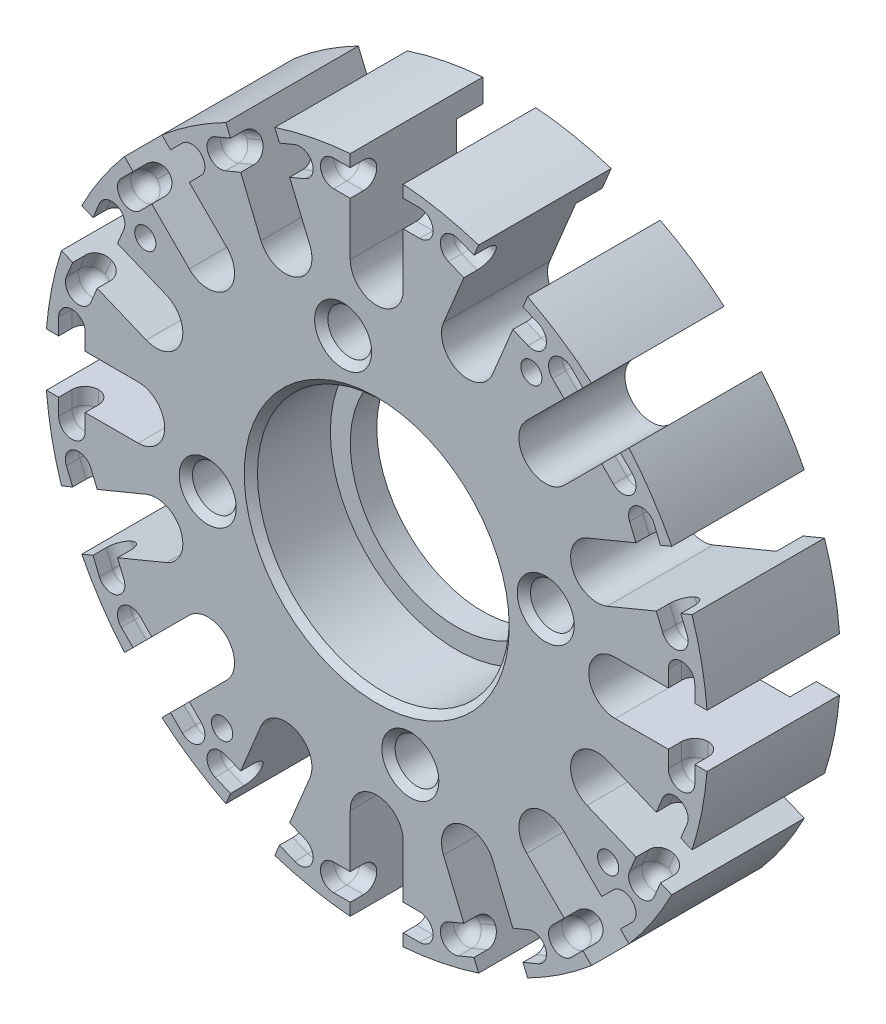
from build123d import *

# Parameters (mm, degrees)
SKETCH_1_R               = 25
EXTRUDE_1_DEPTH          = 10
SKETCH_10_R              = 8
CUT_EXTRUDE_7_DEPTH      = 10
SKETCH_6_R               = 23.25
CUT_EXTRUDE_6_DEPTH      = 2
SKETCH_2_R               = 9.5
CUT_EXTRUDE_2_DEPTH      = 6
SKETCH_3_R               = 1.65
CUT_EXTRUDE_3_DEPTH      = 10
PATTERN_CIRCULAR_1_COUNT = 4
CUT_EXTRUDE_START        = -10
CUT_EXTRUDE_5_DEPTH      = 10
PATTERN_CIRCULAR_3_COUNT = 16
CHAMFER_1_SIZE           = 0.5
CUT_EXTRUDE_10_DEPTH     = 2
FILLET_3_R               = 1
PATTERN_CIRCULAR_6_COUNT = 16
HOLE_WIZARD_M2_1_D       = 1.6
PATTERN_CIRCULAR_7_COUNT = 4
CHAMFER_3_SIZE           = 0.25
CHAMFER_3_SIZE2          = 0.066987298
FILLET_5_R               = 1
FILLET_6_R               = 1


with BuildPart() as part:
    # 草图1 → 拉伸1 (new body)
    with BuildSketch(Plane.XY):
        Circle(SKETCH_1_R)
    extrude(amount=EXTRUDE_1_DEPTH)

    # 草图10 → 拉伸7 (cut)
    with BuildSketch(Plane.XY.offset(10)):
        Circle(SKETCH_10_R)
    extrude(amount=-CUT_EXTRUDE_7_DEPTH, mode=Mode.SUBTRACT)

    # 草图6 → 拉伸6 (cut)
    with BuildSketch(Plane(origin=(0, 0, 0), x_dir=(-1, 0, 0), z_dir=(0, 0, -1))):
        Circle(SKETCH_6_R)
    extrude(amount=-CUT_EXTRUDE_6_DEPTH, mode=Mode.SUBTRACT)

    # 草图2 → 拉伸2 (cut)
    with BuildSketch(Plane.XY.offset(10)):
        Circle(SKETCH_2_R)
    extrude(amount=-CUT_EXTRUDE_2_DEPTH, mode=Mode.SUBTRACT)

    # 草图3 → 拉伸3 (cut)
    with BuildSketch(Plane.XY.offset(10)):
        with Locations((-2.536174186, 12.750208645)):
            Circle(SKETCH_3_R)
    cut_extrude_3 = extrude(amount=-CUT_EXTRUDE_3_DEPTH, mode=Mode.SUBTRACT)

    # 阵列(圆周)1: 拉伸3 ×4 about axis
    pattern_circular_1_axis = Axis((0, 0, 0), (0, 0, 1))
    for i in range(1, PATTERN_CIRCULAR_1_COUNT):
        add(cut_extrude_3.rotate(pattern_circular_1_axis, i * 360 / PATTERN_CIRCULAR_1_COUNT), mode=Mode.SUBTRACT)

    # 草图5 → 拉伸5 (cut)
    with BuildSketch(Plane.XY.offset(10).offset(CUT_EXTRUDE_START)):
        with BuildLine():
            Line((-18, 2), (-24.919871589, 2))
            ThreePointArc((-24.919871589, 2), (-25, 0), (-24.919871589, -2))
            Line((-24.919871589, -2), (-18, -2))
            ThreePointArc((-18, -2), (-16, 0), (-18, 2))
        make_face()
    cut_extrude_5 = extrude(amount=CUT_EXTRUDE_5_DEPTH, mode=Mode.SUBTRACT)

    # 阵列(圆周)3: 拉伸5 ×16 about axis
    pattern_circular_3_axis = Axis((0, 0, 0), (0, 0, 1))
    for i in range(1, PATTERN_CIRCULAR_3_COUNT):
        add(cut_extrude_5.rotate(pattern_circular_3_axis, i * 360 / PATTERN_CIRCULAR_3_COUNT), mode=Mode.SUBTRACT)

    # 倒角1
    chamfer_1_edges = [part.edges().sort_by_distance(p)[0] for p in [
        (-9.5, 0, 10),
        (-4.186174186, 12.750208645, 10),
        (-12.750208645, -4.186174186, 10),
        (4.186174186, -12.750208645, 10),
        (12.750208645, 4.186174186, 10),
    ]]
    chamfer(chamfer_1_edges, length=CHAMFER_1_SIZE)

    # 草图15 → 拉伸10 (cut)
    with BuildSketch(Plane.XY.offset(10)):
        with BuildLine():
            Line((-24, 3.25), (-24, -3.25))
            ThreePointArc((-24, -3.25), (-23, -4.25), (-22, -3.25))
            Line((-22, -3.25), (-22, 3.25))
            ThreePointArc((-22, 3.25), (-23, 4.25), (-24, 3.25))
        make_face()
    cut_extrude_10 = extrude(amount=-CUT_EXTRUDE_10_DEPTH, mode=Mode.SUBTRACT)

    # 圆角3
    fillet_3_edges = [part.edges().sort_by_distance(p)[0] for p in [
        (-22, -2.625, 8),
        (-22, 2.625, 8),
        (-24, -2.625, 8),
        (-24, 2.625, 8),
        (-23, -4.25, 8),
        (-23, 4.25, 8),
    ]]
    fillet(fillet_3_edges, radius=FILLET_3_R - 0.0001)  # a hair under: the kernel refuses the full size

    # 阵列(圆周)6: 拉伸10 ×16 about axis
    pattern_circular_6_axis = Axis((0, 0, 0), (0, 0, 1))
    for i in range(1, PATTERN_CIRCULAR_6_COUNT):
        add(cut_extrude_10.rotate(pattern_circular_6_axis, i * 360 / PATTERN_CIRCULAR_6_COUNT), mode=Mode.SUBTRACT)

    # M2 螺纹孔1 (through all)
    with Locations(Plane(origin=(11.666974893, 17.460861858, 2), x_dir=(-1, 0, 0), z_dir=(0, 0, -1))):
        with Locations((0, 0)):
            hole_wizard_m2_1 = Hole(HOLE_WIZARD_M2_1_D / 2)

    # 阵列(圆周)7: M2 螺纹孔1 ×4 about axis
    pattern_circular_7_axis = Axis((0, 0, 0), (0, 0, 1))
    for i in range(1, PATTERN_CIRCULAR_7_COUNT):
        add(hole_wizard_m2_1.rotate(pattern_circular_7_axis, i * 360 / PATTERN_CIRCULAR_7_COUNT), mode=Mode.SUBTRACT)

    # 倒角3
    chamfer_3_edges = [part.edges().sort_by_distance(p)[0] for p in [
        (10.866974893, 17.460861858, 2),
        (-17.460861858, 10.866974893, 2),
        (-10.866974893, -17.460861858, 2),
        (17.460861858, -10.866974893, 2),
    ]]
    chamfer_3_side = [part.faces().sort_by_distance(p)[0] for p in [
        (-15.344828267, 0, 2),
    ]]
    chamfer(chamfer_3_edges, length=CHAMFER_3_SIZE, length2=CHAMFER_3_SIZE2, reference=chamfer_3_side[0])

    # 圆角5
    fillet_5_edges = [part.edges().sort_by_distance(p)[0] for p in [
        (-17.412504487, -13.700193885, 8),
        (-18.826718049, -15.114407448, 8),
        (-15.114407448, -18.826718049, 8),
        (-13.700193885, -17.412504487, 8),
        (-21.16856477, -11.60958615, 8),
        (-19.320805705, -10.844219285, 8),
        (-21.329893725, -5.993851739, 8),
        (-23.17765279, -6.759218604, 8),
        (-19.268659787, -13.258252147, 8),
        (-13.258252147, -19.268659787, 8),
        (-19.62282466, -12.728206958, 8),
        (-22.875633835, -4.875230931, 8),
    ]]
    fillet(fillet_5_edges, radius=FILLET_5_R - 0.0001)  # a hair under: the kernel refuses the full size

    # 圆角6
    fillet_6_edges = [part.edges().sort_by_distance(p)[0] for p in [
        (-23.17765279, 6.759218604, 8),
        (-21.329893725, 5.993851739, 8),
        (-19.320805705, 10.844219285, 8),
        (-21.16856477, 11.60958615, 8),
        (-18.826718049, 15.114407448, 8),
        (-17.412504487, 13.700193885, 8),
        (-13.700193885, 17.412504487, 8),
        (-15.114407448, 18.826718049, 8),
        (-11.60958615, 21.16856477, 8),
        (-10.844219285, 19.320805705, 8),
        (-5.993851739, 21.329893725, 8),
        (-6.759218604, 23.17765279, 8),
        (-2.625, 24, 8),
        (-2.625, 22, 8),
        (2.625, 22, 8),
        (2.625, 24, 8),
        (6.759218604, 23.17765279, 8),
        (5.993851739, 21.329893725, 8),
        (10.844219285, 19.320805705, 8),
        (11.60958615, 21.16856477, 8),
        (15.114407448, 18.826718049, 8),
        (13.700193885, 17.412504487, 8),
        (17.412504487, 13.700193885, 8),
        (18.826718049, 15.114407448, 8),
        (21.16856477, 11.60958615, 8),
        (19.320805705, 10.844219285, 8),
        (21.329893725, 5.993851739, 8),
        (23.17765279, 6.759218604, 8),
        (24, 2.625, 8),
        (22, 2.625, 8),
        (22, -2.625, 8),
        (24, -2.625, 8),
        (23.17765279, -6.759218604, 8),
        (21.329893725, -5.993851739, 8),
        (19.320805705, -10.844219285, 8),
        (21.16856477, -11.60958615, 8),
        (18.826718049, -15.114407448, 8),
        (17.412504487, -13.700193885, 8),
        (13.700193885, -17.412504487, 8),
        (15.114407448, -18.826718049, 8),
        (11.60958615, -21.16856477, 8),
        (10.844219285, -19.320805705, 8),
        (5.993851739, -21.329893725, 8),
        (6.759218604, -23.17765279, 8),
        (2.625, -24, 8),
        (2.625, -22, 8),
        (-2.625, -22, 8),
        (-2.625, -24, 8),
        (-6.759218604, -23.17765279, 8),
        (-5.993851739, -21.329893725, 8),
        (-10.844219285, -19.320805705, 8),
        (-11.60958615, -21.16856477, 8),
        (-22.875633835, 4.875230931, 8),
        (-19.62282466, 12.728206958, 8),
        (-19.268659787, 13.258252147, 8),
        (-13.258252147, 19.268659787, 8),
        (-12.728206958, 19.62282466, 8),
        (-4.875230931, 22.875633835, 8),
        (-4.25, 23, 8),
        (4.25, 23, 8),
        (4.875230931, 22.875633835, 8),
        (12.728206958, 19.62282466, 8),
        (13.258252147, 19.268659787, 8),
        (19.268659787, 13.258252147, 8),
        (19.62282466, 12.728206958, 8),
        (22.875633835, 4.875230931, 8),
        (23, 4.25, 8),
        (23, -4.25, 8),
        (22.875633835, -4.875230931, 8),
        (19.62282466, -12.728206958, 8),
        (19.268659787, -13.258252147, 8),
        (13.258252147, -19.268659787, 8),
        (12.728206958, -19.62282466, 8),
        (4.875230931, -22.875633835, 8),
        (4.25, -23, 8),
        (-4.25, -23, 8),
        (-4.875230931, -22.875633835, 8),
        (-12.728206958, -19.62282466, 8),
    ]]
    fillet(fillet_6_edges, radius=FILLET_6_R - 0.0001)  # a hair under: the kernel refuses the full size


solid = part.part
